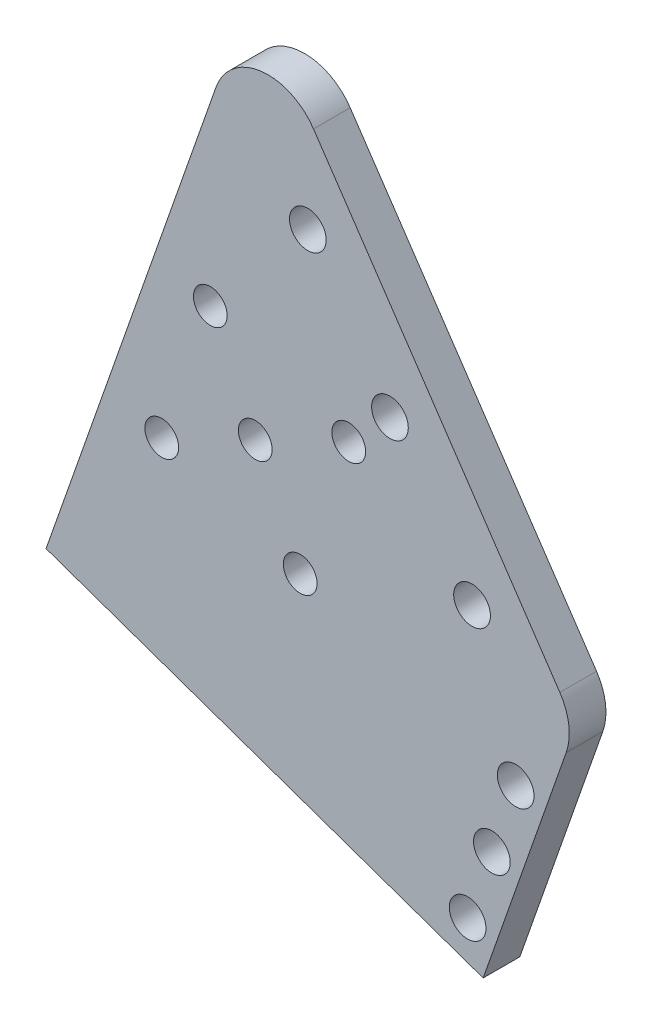
from build123d import *

# Parameters (mm, degrees)
SKETCH1_R           = 3.175
BOSS_EXTRUDE2_DEPTH = 6.35
SKETCH2_R           = 2.921
CUT_EXTRUDE1_DEPTH  = 97.740796727


with BuildPart() as part:
    # Sketch1 → Boss-Extrude2 (new body)
    with BuildSketch(Plane.XY):
        with BuildLine():
            Line((-13.229381943, 36.614978912), (29.410930021, -26.537564946))
            ThreePointArc((29.410930021, -26.537564946), (30.963576381, -30.648910737), (30.505184963, -35.019694677))
            Line((30.505184963, -35.019694677), (16.137407283, -75.990033508))
            Line((16.137407283, -75.990033508), (-59.531286387, -49.453983307))
            Line((-59.531286387, -49.453983307), (-30.111772849, 34.437030653))
            ThreePointArc((-30.111772849, 34.437030653), (-22.342143128, 40.731654259), (-13.229381943, 36.614978912))
        make_face()
        with Locations((-14.213437321, 21.050847952)):
            Circle(SKETCH1_R, mode=Mode.SUBTRACT)
        with Locations((14.213437321, -21.050847952)):
            Circle(SKETCH1_R, mode=Mode.SUBTRACT)
        Circle(SKETCH1_R, mode=Mode.SUBTRACT)
        with Locations((13.445028881, -68.316703166)):
            Circle(SKETCH1_R, mode=Mode.SUBTRACT)
        with Locations((17.64781653, -56.3322726)):
            Circle(SKETCH1_R, mode=Mode.SUBTRACT)
        with Locations((21.766636919, -44.318725305)):
            Circle(SKETCH1_R, mode=Mode.SUBTRACT)
    extrude(amount=BOSS_EXTRUDE2_DEPTH)

    # Sketch2 → Cut-Extrude1 (cut, through all)
    with BuildSketch(Plane(origin=(0, 0, 0), x_dir=(-1, 0, 0), z_dir=(0, 0, -1))):
        with Locations((7.130655561, -7.267892509)):
            Circle(SKETCH2_R)
        with Locations((31.099516692, 1.137682787)):
            Circle(SKETCH2_R)
        with Locations((15.536230857, -31.236753641)):
            Circle(SKETCH2_R)
        with Locations((39.505091988, -22.831178344)):
            Circle(SKETCH2_R)
        with Locations((23.317873774, -15.049535427)):
            Circle(SKETCH2_R)
    extrude(amount=-CUT_EXTRUDE1_DEPTH, mode=Mode.SUBTRACT)


solid = part.part
